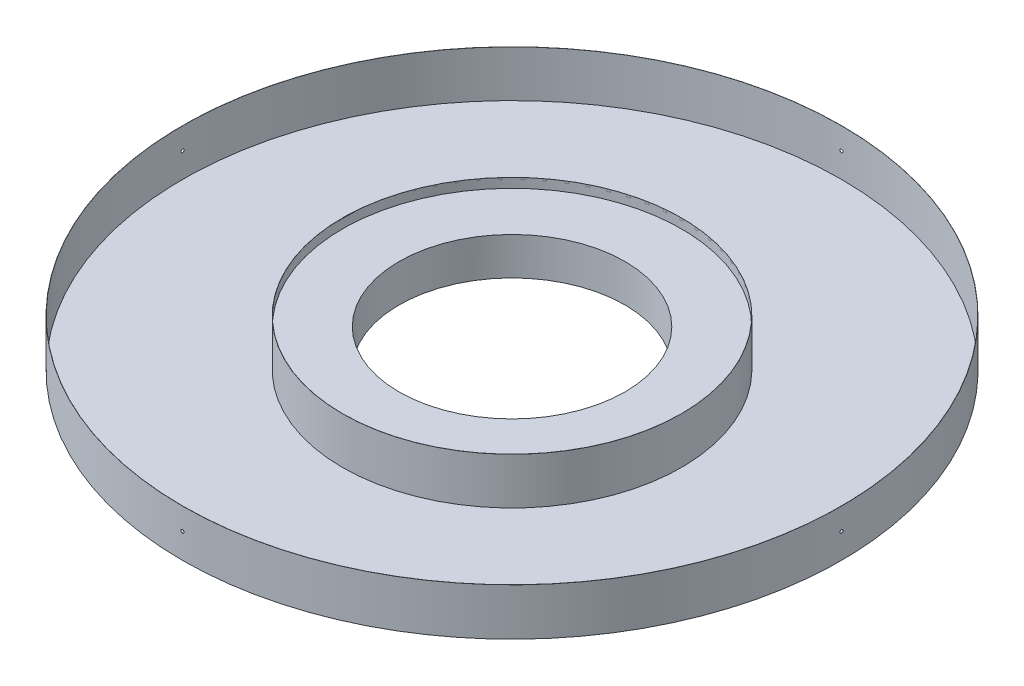
from build123d import *

# Parameters (mm, degrees)
SKETCH1_R               = 1750
BOSS_EXTRUDE1_DEPTH     = 500
SKETCH2_R               = 900
CUT_EXTRUDE2_DEPTH      = 300
SKETCH3_R               = 600
CUT_EXTRUDE3_DEPTH      = 300
SKETCH4_R               = 1749.25
SKETCH4_R_2             = 900.75
CUT_EXTRUDE4_DEPTH      = 497
CUT_EXTRUDE5_DEPTH      = 2525.876234591
CUT_EXTRUDE5_DEPTH_BACK = 2525.876234591
SKETCH7_R               = 8.382
CUT_EXTRUDE6_DEPTH      = 500
CIRPATTERN1_COUNT       = 4
CUT_EXTRUDE8_DEPTH      = 10


with BuildPart() as part:
    # Sketch1 → Boss-Extrude1 (new body)
    with BuildSketch(Plane(origin=(0, 0, 0), x_dir=(1, 0, 0), z_dir=(0, 1, 0))):
        Circle(SKETCH1_R)
    extrude(amount=BOSS_EXTRUDE1_DEPTH)

    # Sketch2 → Cut-Extrude2 (cut)
    with BuildSketch(Plane(origin=(0, 500, 0), x_dir=(1, 0, 0), z_dir=(0, 1, 0))):
        Circle(SKETCH2_R)
    extrude(amount=-CUT_EXTRUDE2_DEPTH, mode=Mode.SUBTRACT)

    # Sketch3 → Cut-Extrude3 (cut)
    with BuildSketch(Plane.XZ):
        Circle(SKETCH3_R)
    extrude(amount=-CUT_EXTRUDE3_DEPTH, mode=Mode.SUBTRACT)

    # Sketch4 → Cut-Extrude4 (cut)
    with BuildSketch(Plane(origin=(0, 500, 0), x_dir=(1, 0, 0), z_dir=(0, 1, 0))):
        Circle(SKETCH4_R)
        Circle(SKETCH4_R_2, mode=Mode.SUBTRACT)
    extrude(amount=-CUT_EXTRUDE4_DEPTH, mode=Mode.SUBTRACT)

    # Sketch6 → Cut-Extrude5 (cut, two sides: drawn at the far end of the back side and taken through both)
    with BuildSketch(Plane(origin=(0, 0, 0), x_dir=(0, 0, -1), z_dir=(1, 0, 0)).offset(-CUT_EXTRUDE5_DEPTH_BACK)):
        Polygon((-1750, 250), (0, 250), (1750, 250), (1750, 500), (-1750, 500), align=None)
    extrude(amount=CUT_EXTRUDE5_DEPTH + CUT_EXTRUDE5_DEPTH_BACK, mode=Mode.SUBTRACT)

    # Sketch7 → Cut-Extrude6 (cut)
    with BuildSketch(Plane.XY.offset(2000)):
        with Locations((0, 133.897639423)):
            Circle(SKETCH7_R)
    cut_extrude6 = extrude(amount=-CUT_EXTRUDE6_DEPTH, mode=Mode.SUBTRACT)

    # CirPattern1: Cut-Extrude6 ×4 about axis
    cirpattern1_axis = Axis((0, 500, 0), (0, -1, 0))
    for i in range(1, CIRPATTERN1_COUNT):
        add(cut_extrude6.rotate(cirpattern1_axis, i * 360 / CIRPATTERN1_COUNT), mode=Mode.SUBTRACT)

    # Sketch8 → Cut-Extrude8 (cut)
    with BuildSketch(Plane(origin=(-1237.436867076, 0, 1237.436867076), x_dir=(0, -1, 0), z_dir=(-0.7071067811865488, 0, 0.7071067811865464))):
        Polygon((-147.428323647, -15.947222151), (-124.875545799, -38.5), (-92.981101496, -38.5), (-70.428323647, -15.947222151), (-70.428323647, 15.947222151), (-92.981101496, 38.5), (-124.875545799, 38.5), (-147.428323647, 15.947222151), align=None)
    extrude(amount=-CUT_EXTRUDE8_DEPTH, mode=Mode.SUBTRACT)


solid = part.part
